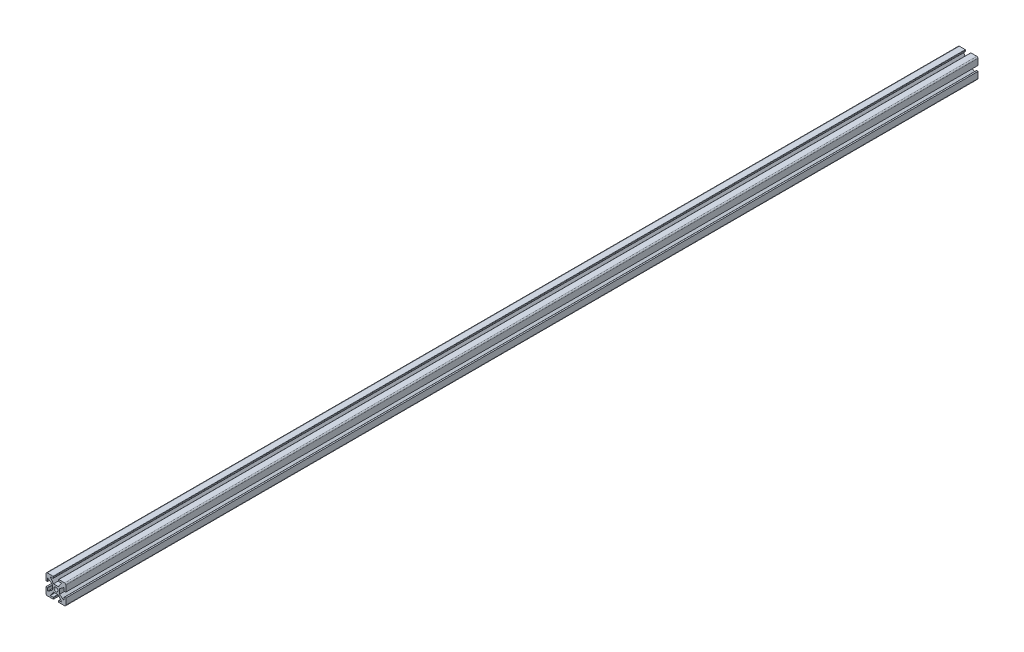
from build123d import *

# Parameters (mm, degrees)
SKETCH1_W           = 25.4
SKETCH1_H           = 25.4
BOSS_EXTRUDE1_DEPTH = 1168.4
FILLET1_R           = 1.5875
HOLE1_OUTLINE_R     = 2.5527
HOLE1_DEPTH         = 1168.4
SKETCH7_W           = 6.5278
SKETCH7_H           = 2.2352
CUT_EXTRUDE2_DEPTH  = 1168.4
FILLET4_R           = 0.396875
CIRPATTERN2_DEPTH   = 1168.4


# Read off the part's stored shape, not the designer's step: Hole1, CirPattern2
with BuildPart() as part:
    # Sketch1 → Boss-Extrude1 (new body)
    with BuildSketch(Plane.XY):
        Rectangle(SKETCH1_W, SKETCH1_H)
    extrude(amount=BOSS_EXTRUDE1_DEPTH)

    # Fillet1
    fillet1_edges = [part.edges().sort_by_distance(p)[0] for p in [
        (12.7, -12.7, 584.2),
        (-12.7, -12.7, 584.2),
        (-12.7, 12.7, 584.2),
        (12.7, 12.7, 584.2),
    ]]
    fillet(fillet1_edges, radius=FILLET1_R)

    # Hole1 outline → Hole1 (cut)
    with BuildSketch(Plane.XY):
        with Locations((0, -0.048792482)):
            Circle(HOLE1_OUTLINE_R)
    extrude(amount=HOLE1_DEPTH, mode=Mode.SUBTRACT)

    # Sketch7 → Cut-Extrude2 (cut)
    with BuildSketch(Plane.XY.offset(1168.4)):
        with Locations((0, 11.5824)):
            Rectangle(SKETCH7_W, SKETCH7_H)
        Polygon((-3.175, 4.5212), (-7.3025, 10.4648), (7.3025, 10.4648), (3.175, 4.5212), align=None)
    extrude(amount=-CUT_EXTRUDE2_DEPTH, mode=Mode.SUBTRACT)

    # Fillet4
    fillet4_edges = [part.edges().sort_by_distance(p)[0] for p in [
        (-3.2639, 10.4648, 584.2),
        (-3.2639, 12.7, 584.2),
        (3.2639, 12.7, 584.2),
        (3.2639, 10.4648, 584.2),
    ]]
    fillet(fillet4_edges, radius=FILLET4_R)

    # CirPattern2 outline → CirPattern2 (cut)
    with BuildSketch(Plane.XY):
        with BuildLine():
            ThreePointArc((-3.660775, -10.562384964), (-3.380141996, -10.67862696), (-3.2639, -10.959259964))
            Line((-3.2639, -10.959259964), (-3.2639, -12.7))
            Line((-3.2639, -12.7), (3.2639, -12.7))
            Line((3.2639, -12.7), (3.2639, -10.959259964))
            ThreePointArc((3.2639, -10.959259964), (3.380141996, -10.67862696), (3.660775, -10.562384964))
            Line((3.660775, -10.562384964), (7.3025, -10.562384964))
            Line((7.3025, -10.562384964), (3.175, -4.618784964))
            Line((3.175, -4.618784964), (-3.175, -4.618784964))
            Line((-3.175, -4.618784964), (-7.3025, -10.562384964))
            Line((-7.3025, -10.562384964), (-3.660775, -10.562384964))
        make_face()
        with BuildLine():
            Line((-12.7, -3.312692482), (-10.910467482, -3.312692482))
            ThreePointArc((-10.910467482, -3.312692482), (-10.629834478, -3.428934478), (-10.513592482, -3.709567482))
            Line((-10.513592482, -3.709567482), (-10.513592482, -7.351292482))
            Line((-10.513592482, -7.351292482), (-4.569992482, -3.223792482))
            Line((-4.569992482, -3.223792482), (-4.569992482, 3.126207518))
            Line((-4.569992482, 3.126207518), (-10.513592482, 7.253707518))
            Line((-10.513592482, 7.253707518), (-10.513592482, 3.611982518))
            ThreePointArc((-10.513592482, 3.611982518), (-10.629834478, 3.331349514), (-10.910467482, 3.215107518))
            Line((-10.910467482, 3.215107518), (-12.7, 3.215107518))
            Line((-12.7, 3.215107518), (-12.7, -3.312692482))
        make_face()
        with BuildLine():
            ThreePointArc((10.513592482, -3.709567482), (10.629834478, -3.428934478), (10.910467482, -3.312692482))
            Line((10.910467482, -3.312692482), (12.7, -3.312692482))
            Line((12.7, -3.312692482), (12.7, 3.215107518))
            Line((12.7, 3.215107518), (10.910467482, 3.215107518))
            ThreePointArc((10.910467482, 3.215107518), (10.629834478, 3.331349514), (10.513592482, 3.611982518))
            Line((10.513592482, 3.611982518), (10.513592482, 7.253707518))
            Line((10.513592482, 7.253707518), (4.569992482, 3.126207518))
            Line((4.569992482, 3.126207518), (4.569992482, -3.223792482))
            Line((4.569992482, -3.223792482), (10.513592482, -7.351292482))
            Line((10.513592482, -7.351292482), (10.513592482, -3.709567482))
        make_face()
    extrude(amount=CIRPATTERN2_DEPTH, mode=Mode.SUBTRACT)


solid = part.part
